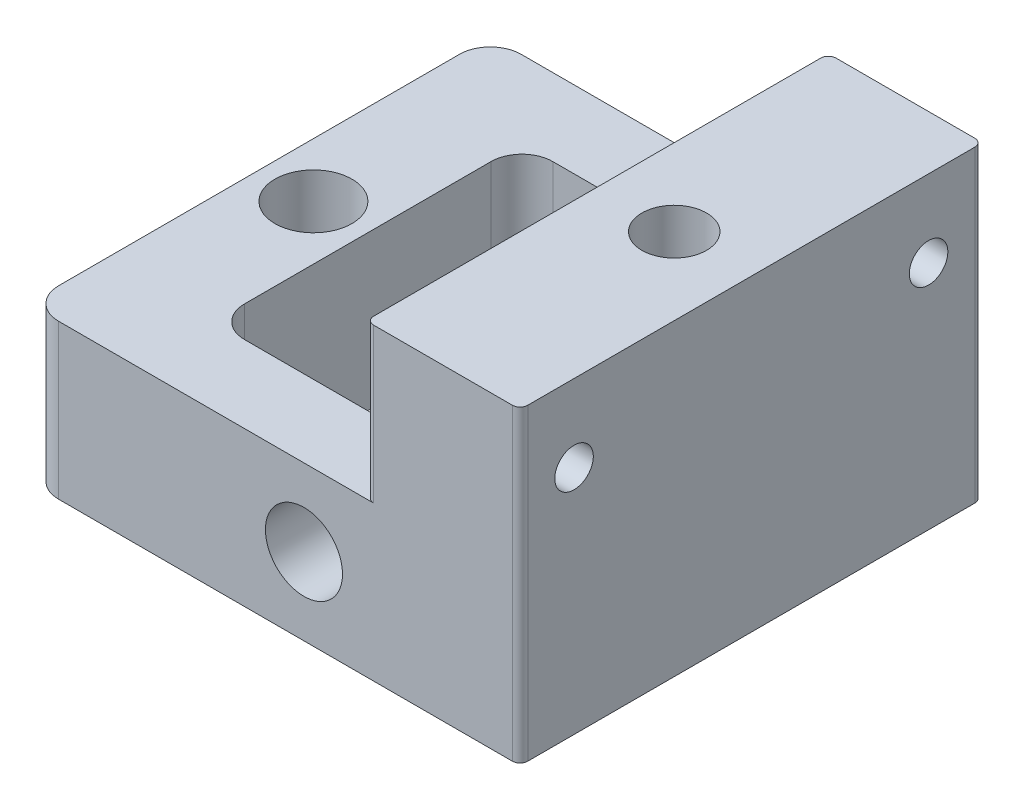
from build123d import *

# Parameters (mm, degrees)
SKETCH1_W                   = 31.93
SKETCH1_H                   = 30
SKETCH1_W_2                 = 14.88
SKETCH1_H_2                 = 20
BOSS_EXTRUDE1_DEPTH         = 10
SKETCH2_W                   = 10
SKETCH2_H                   = 30
BOSS_EXTRUDE2_DEPTH         = 10
TAP_DRILL_FOR_M5X0_8_TAP1_D = 4.2
FILLET2_R                   = 2
SKETCH5_R                   = 2.5
CUT_EXTRUDE2_DEPTH          = 37.457558887
TAP_DRILL_FOR_M4X0_7_TAP1_D = 3.3
FILLET3_R                   = 2
FILLET4_R                   = 0.5
TAP_DRILL_FOR_M3X0_5_TAP1_D = 2.5
F_5_0_5_DIAMETER_HOLE1_D    = 5


with BuildPart() as part:
    # Sketch1 → Boss-Extrude1 (new body)
    with BuildSketch(Plane(origin=(0, 0, 0), x_dir=(1, 0, 0), z_dir=(0, 1, 0))):
        with Locations((1.475, 0)):
            Rectangle(SKETCH1_W, SKETCH1_H)
        Rectangle(SKETCH1_W_2, SKETCH1_H_2, mode=Mode.SUBTRACT)
    extrude(amount=BOSS_EXTRUDE1_DEPTH)

    # Sketch2 → Boss-Extrude2 (add)
    with BuildSketch(Plane(origin=(0, 10, 0), x_dir=(1, 0, 0), z_dir=(0, 1, 0))):
        with Locations((12.44, 0)):
            Rectangle(SKETCH2_W, SKETCH2_H)
    extrude(amount=BOSS_EXTRUDE2_DEPTH)

    # Tap Drill for M5x0.8 Tap1 (through all)
    with Locations(Plane(origin=(0, 20, 0), x_dir=(1, 0, 0), z_dir=(0, 1, 0))):
        with Locations((12.44, 0)):
            Hole(TAP_DRILL_FOR_M5X0_8_TAP1_D / 2)

    # Fillet2
    fillet2_edges = [part.edges().sort_by_distance(p)[0] for p in [
        (-7.44, 5, 10),
        (-7.44, 5, -10),
        (7.44, 5, -10),
        (7.44, 5, 10),
    ]]
    fillet(fillet2_edges, radius=FILLET2_R)

    # Sketch5 → Cut-Extrude2 (cut, through all)
    with BuildSketch(Plane.XY.offset(-10)):
        with Locations((3.42, 5)):
            Circle(SKETCH5_R)
    extrude(amount=CUT_EXTRUDE2_DEPTH, mode=Mode.SUBTRACT)

    # Tap Drill for M4x0.7 Tap1 (through all)
    with Locations(Plane.XY.offset(-10)):
        with Locations((3.42, 5)):
            Hole(TAP_DRILL_FOR_M4X0_7_TAP1_D / 2)

    # Fillet3
    fillet3_edges = [part.edges().sort_by_distance(p)[0] for p in [
        (-14.49, 5, -15),
        (-14.49, 5, 15),
    ]]
    fillet(fillet3_edges, radius=FILLET3_R)

    # Fillet4
    fillet4_edges = [part.edges().sort_by_distance(p)[0] for p in [
        (17.44, 10, 15),
        (17.44, 10, -15),
        (7.44, 15, -15),
        (7.44, 15, 15),
    ]]
    fillet(fillet4_edges, radius=FILLET4_R)

    # Tap Drill for M3x0.5 Tap1 (through all)
    with Locations(Plane.ZY.offset(-7.44)):
        with Locations((-11.5, 15), (11.5, 15)):
            Hole(TAP_DRILL_FOR_M3X0_5_TAP1_D / 2)

    # Ø5.0 (5) Diameter Hole1 (through all)
    with Locations(Plane(origin=(0, 10, 0), x_dir=(1, 0, 0), z_dir=(0, 1, 0))):
        with Locations((-10.965, 0)):
            Hole(F_5_0_5_DIAMETER_HOLE1_D / 2)


solid = part.part
